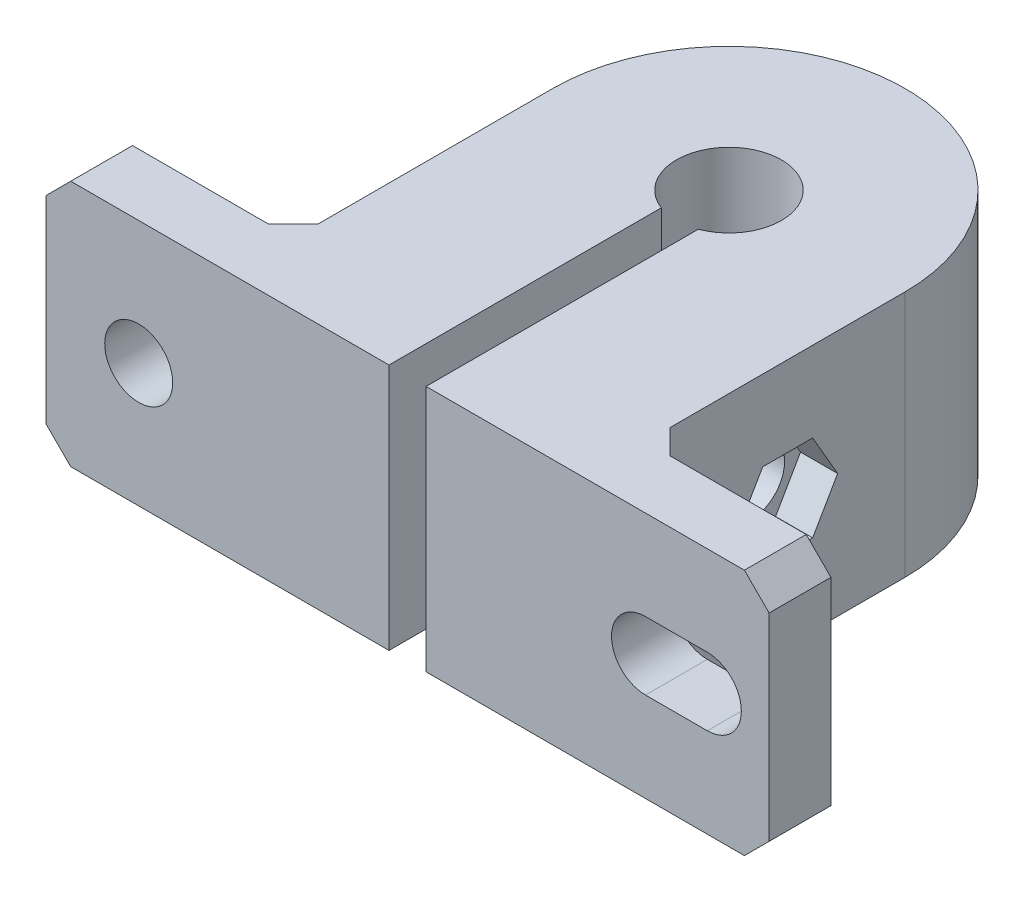
from build123d import *

# Parameters (mm, degrees)
SKETCH1_R                    = 4.25
BOSS_EXTRUDE1_DEPTH          = 20
CUT_EXTRUDE_THIN1_DEPTH      = 36.763983279
CUT_EXTRUDE_THIN1_DEPTH_BACK = 20
SKETCH3_W                    = 3
SKETCH3_H                    = 26
SKETCH4_W                    = 27.75
SKETCH4_H                    = 20
BOSS_EXTRUDE2_DEPTH          = 5
SKETCH5_R                    = 2.75
CUT_EXTRUDE1_DEPTH           = 5
CHAMFER1_SIZE                = 2
CHAMFER2_SIZE                = 2
SKETCH6_R                    = 2.75
CUT_EXTRUDE2_DEPTH           = 35
CUT_EXTRUDE3_DEPTH           = 3
SKETCH8_R                    = 4
CUT_EXTRUDE4_DEPTH           = 4


with BuildPart() as part:
    # Sketch1 → Boss-Extrude1 (new body)
    with BuildSketch(Plane(origin=(0, 0, 0), x_dir=(1, 0, 0), z_dir=(0, 1, 0))):
        with BuildLine():
            Line((-14.25, 0), (-14.25, -26))
            Line((-14.25, -26), (14.25, -26))
            Line((14.25, -26), (14.25, 0))
            ThreePointArc((14.25, 0), (0, 14.25), (-14.25, 0))
        make_face()
        Circle(SKETCH1_R, mode=Mode.SUBTRACT)
    extrude(amount=BOSS_EXTRUDE1_DEPTH)

    # Sketch3 → Cut-Extrude-Thin1 (cut, two sides: drawn at the far end of the back side and taken through both)
    with BuildSketch(Plane(origin=(0, 20, 0), x_dir=(1, 0, 0), z_dir=(0, 1, 0)).offset(-CUT_EXTRUDE_THIN1_DEPTH_BACK)):
        with Locations((0, -13)):
            Rectangle(SKETCH3_W, SKETCH3_H)
    extrude(amount=CUT_EXTRUDE_THIN1_DEPTH + CUT_EXTRUDE_THIN1_DEPTH_BACK, mode=Mode.SUBTRACT)

    # Sketch4 → Boss-Extrude2 (add)
    with BuildSketch(Plane.XY.offset(26)):
        with Locations((-15.375, 10)):
            Rectangle(SKETCH4_W, SKETCH4_H)
    boss_extrude2 = extrude(amount=-BOSS_EXTRUDE2_DEPTH)

    # Mirror1: Boss-Extrude2 across plane
    add(boss_extrude2.mirror(Plane(origin=(0, 0, 0), x_dir=(0, 0, 1), z_dir=(1, 0, 0))))

    # Sketch5 → Cut-Extrude1 (cut)
    with BuildSketch(Plane(origin=(0, 0, 21), x_dir=(-1, 0, 0), z_dir=(0, 0, -1))):
        with Locations((21.75, 10)):
            Circle(SKETCH5_R)
        with BuildLine():
            Line((-24.25, 12.75), (-19.25, 12.75))
            ThreePointArc((-19.25, 12.75), (-16.5, 10), (-19.25, 7.25))
            Line((-19.25, 7.25), (-24.25, 7.25))
            ThreePointArc((-24.25, 7.25), (-27, 10), (-24.25, 12.75))
        make_face()
    extrude(amount=-CUT_EXTRUDE1_DEPTH, mode=Mode.SUBTRACT)

    # Chamfer1
    chamfer1_edges = [part.edges().sort_by_distance(p)[0] for p in [
        (-14.25, 10, 21),
        (14.25, 10, 21),
    ]]
    chamfer(chamfer1_edges, length=CHAMFER1_SIZE)

    # Chamfer2
    chamfer2_edges = [part.edges().sort_by_distance(p)[0] for p in [
        (29.25, 0, 23.5),
        (29.25, 20, 23.5),
        (-29.25, 0, 23.5),
        (-29.25, 20, 23.5),
    ]]
    chamfer(chamfer2_edges, length=CHAMFER2_SIZE)

    # Sketch6 → Cut-Extrude2 (cut)
    with BuildSketch(Plane(origin=(14.25, 0, 0), x_dir=(0, 0, -1), z_dir=(1, 0, 0))):
        with Locations((-9.5, 10)):
            Circle(SKETCH6_R)
    extrude(amount=-CUT_EXTRUDE2_DEPTH, mode=Mode.SUBTRACT)

    # Sketch7 → Cut-Extrude3 (cut)
    with BuildSketch(Plane(origin=(14.25, 0, 0), x_dir=(0, 0, -1), z_dir=(1, 0, 0))):
        Polygon((-13.541451884, 10), (-11.520725942, 6.5), (-7.479274058, 6.5), (-5.458548116, 10), (-7.479274058, 13.5), (-11.520725942, 13.5), align=None)
    extrude(amount=-CUT_EXTRUDE3_DEPTH, mode=Mode.SUBTRACT)

    # Sketch8 → Cut-Extrude4 (cut)
    with BuildSketch(Plane.ZY.offset(14.25)):
        with Locations((9.5, 10)):
            Circle(SKETCH8_R)
    extrude(amount=-CUT_EXTRUDE4_DEPTH, mode=Mode.SUBTRACT)


solid = part.part
